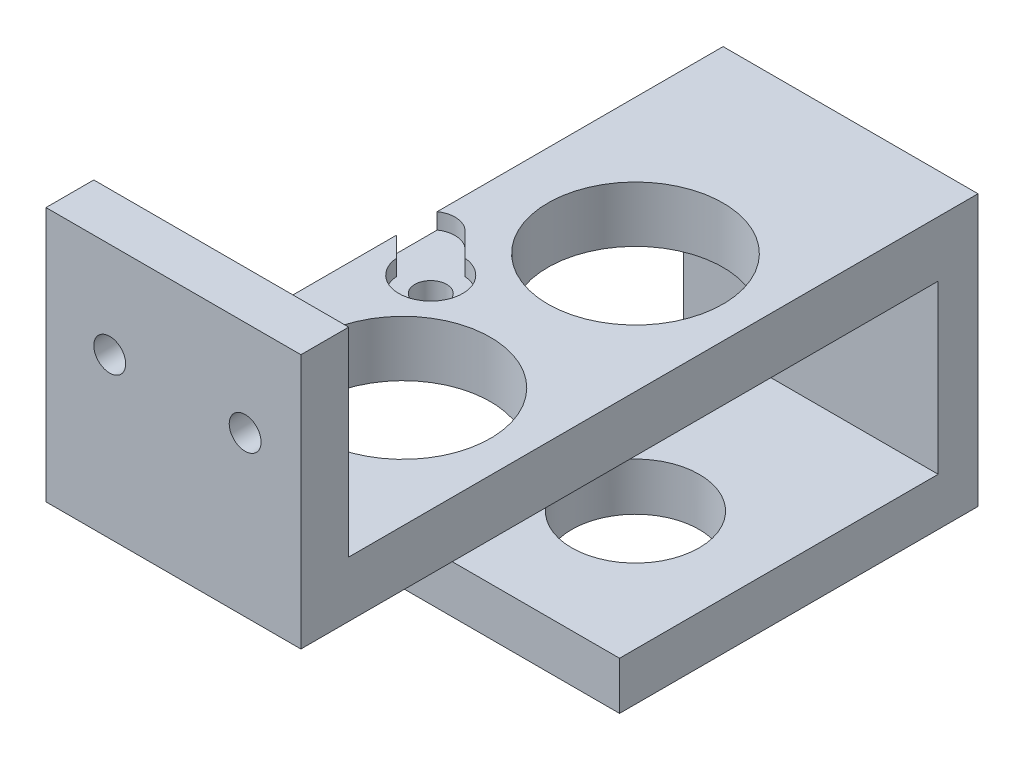
from build123d import *

# Parameters (mm, degrees)
SKETCH1_W           = 32
SKETCH1_H           = 85
BOSS_EXTRUDE1_DEPTH = 7
SKETCH2_R           = 11
CUT_EXTRUDE1_DEPTH  = 100
SKETCH3_R           = 11
CUT_EXTRUDE2_DEPTH  = 7
SKETCH4_W           = 32
SKETCH4_H           = 6
BOSS_EXTRUDE3_DEPTH = 25
SKETCH5_R           = 2
CUT_EXTRUDE3_DEPTH  = 14
SKETCH6_R           = 2
CUT_EXTRUDE4_DEPTH  = 14
SKETCH10_W          = 32
SKETCH10_H          = 5
BOSS_EXTRUDE4_DEPTH = 27
SKETCH11_W          = 32
SKETCH11_H          = 6
BOSS_EXTRUDE5_DEPTH = 40
SKETCH9_R           = 8
CUT_EXTRUDE5_DEPTH  = 40
SKETCH13_R          = 4
CUT_EXTRUDE6_DEPTH  = 2
CUT_EXTRUDE9_DEPTH  = 2


with BuildPart() as part:
    # Sketch1 → Boss-Extrude1 (new body)
    with BuildSketch(Plane(origin=(0, 0, 0), x_dir=(1, 0, 0), z_dir=(0, 1, 0))):
        with Locations((-34.16194332, -13.734817814)):
            Rectangle(SKETCH1_W, SKETCH1_H)
    extrude(amount=BOSS_EXTRUDE1_DEPTH)

    # Sketch2 → Cut-Extrude1 (cut)
    with BuildSketch(Plane(origin=(0, 7, 0), x_dir=(1, 0, 0), z_dir=(0, 1, 0))):
        with Locations((-33.16194332, 0.765182186)):
            Circle(SKETCH2_R)
    extrude(amount=-CUT_EXTRUDE1_DEPTH, mode=Mode.SUBTRACT)

    # Sketch3 → Cut-Extrude2 (cut)
    with BuildSketch(Plane(origin=(0, 7, 0), x_dir=(1, 0, 0), z_dir=(0, 1, 0))):
        with Locations((-33.16194332, -28.434817814)):
            Circle(SKETCH3_R)
    extrude(amount=-CUT_EXTRUDE2_DEPTH, mode=Mode.SUBTRACT)

    # Sketch4 → Boss-Extrude3 (add)
    with BuildSketch(Plane(origin=(0, 7, 0), x_dir=(1, 0, 0), z_dir=(0, 1, 0))):
        with Locations((-34.16194332, -53.234817814)):
            Rectangle(SKETCH4_W, SKETCH4_H)
    extrude(amount=BOSS_EXTRUDE3_DEPTH)

    # Sketch5 → Cut-Extrude3 (cut)
    with BuildSketch(Plane(origin=(0, 0, 50.234817814), x_dir=(-1, 0, 0), z_dir=(0, 0, -1))):
        with Locations((42.16194332, 20)):
            Circle(SKETCH5_R)
        with Locations((25.16194332, 20)):
            Circle(SKETCH5_R)
    extrude(amount=-CUT_EXTRUDE3_DEPTH, mode=Mode.SUBTRACT)

    # Sketch6 → Cut-Extrude4 (cut)
    with BuildSketch(Plane(origin=(0, 7, 0), x_dir=(1, 0, 0), z_dir=(0, 1, 0))):
        with Locations((-43.66194332, -14.434817814)):
            Circle(SKETCH6_R)
        with Locations((-43.66194332, -42.434817814)):
            Circle(SKETCH6_R)
    extrude(amount=-CUT_EXTRUDE4_DEPTH, mode=Mode.SUBTRACT)

    # Sketch10 → Boss-Extrude4 (add)
    with BuildSketch(Plane.XZ):
        with Locations((-34.16194332, -26.265182186)):
            Rectangle(SKETCH10_W, SKETCH10_H)
    extrude(amount=BOSS_EXTRUDE4_DEPTH)

    # Sketch11 → Boss-Extrude5 (add)
    with BuildSketch(Plane.XY.offset(-23.765182186)):
        with Locations((-34.16194332, -24)):
            Rectangle(SKETCH11_W, SKETCH11_H)
    extrude(amount=BOSS_EXTRUDE5_DEPTH)

    # Sketch9 → Cut-Extrude5 (cut)
    with BuildSketch(Plane(origin=(0, 7, 0), x_dir=(1, 0, 0), z_dir=(0, 1, 0))):
        with Locations((-33.16194332, 0.765182186)):
            Circle(SKETCH9_R)
    extrude(amount=-CUT_EXTRUDE5_DEPTH, mode=Mode.SUBTRACT)

    # Sketch13 → Cut-Extrude6 (cut)
    with BuildSketch(Plane(origin=(0, 7, 0), x_dir=(1, 0, 0), z_dir=(0, 1, 0))):
        with Locations((-43.66194332, -14.434817814)):
            Circle(SKETCH13_R)
        with Locations((-43.66194332, -42.434817814)):
            Circle(SKETCH13_R)
    extrude(amount=-CUT_EXTRUDE6_DEPTH, mode=Mode.SUBTRACT)

    # Sketch15 → Cut-Extrude9 (cut)
    with BuildSketch(Plane(origin=(0, 7, 0), x_dir=(1, 0, 0), z_dir=(0, 1, 0))):
        with BuildLine():
            Line((-45.819303215, -16.592177709), (-50.604875862, -11.806605062))
            ThreePointArc((-50.604875862, -11.806605062), (-50.604875862, -7.491885272), (-46.290156072, -7.491885272))
            Line((-46.290156072, -7.491885272), (-41.504583425, -12.277457919))
            ThreePointArc((-41.504583425, -12.277457919), (-41.504583425, -16.592177709), (-45.819303215, -16.592177709))
        make_face()
        with BuildLine():
            Line((-41.316782848, -44.779978286), (-46.538440027, -50.001635465))
            ThreePointArc((-46.538440027, -50.001635465), (-51.228760971, -50.001635465), (-51.228760971, -45.311314521))
            Line((-51.228760971, -45.311314521), (-46.007103792, -40.089657342))
            ThreePointArc((-46.007103792, -40.089657342), (-41.316782848, -40.089657342), (-41.316782848, -44.779978286))
        make_face()
    extrude(amount=-CUT_EXTRUDE9_DEPTH, mode=Mode.SUBTRACT)


solid = part.part
